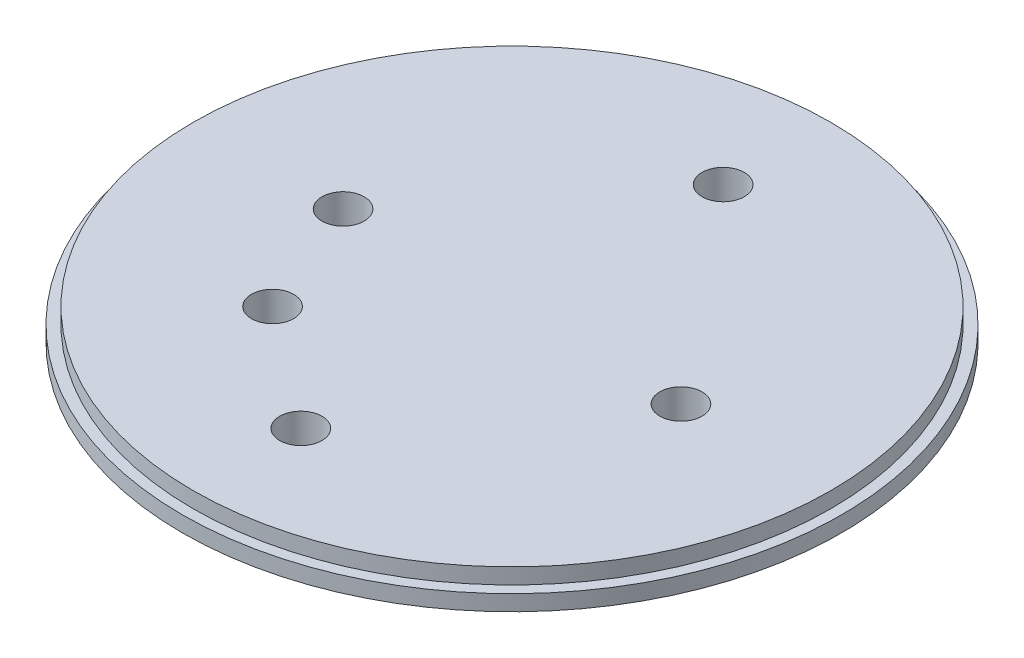
from build123d import *

# Parameters (mm, degrees)
SKETCH1_R           = 49.55
BOSS_EXTRUDE1_DEPTH = 2.36
SKETCH2_R           = 47.95
BOSS_EXTRUDE2_DEPTH = 2.36
SKETCH3_R           = 3.175
CUT_EXTRUDE1_DEPTH  = 71.233064863


with BuildPart() as part:
    # Sketch1 → Boss-Extrude1 (new body)
    with BuildSketch(Plane(origin=(0, 0, 0), x_dir=(1, 0, 0), z_dir=(0, 1, 0))):
        Circle(SKETCH1_R)
    extrude(amount=BOSS_EXTRUDE1_DEPTH)

    # Sketch2 → Boss-Extrude2 (add)
    with BuildSketch(Plane(origin=(0, 2.36, 0), x_dir=(1, 0, 0), z_dir=(0, 1, 0))):
        Circle(SKETCH2_R)
    extrude(amount=BOSS_EXTRUDE2_DEPTH)

    # Sketch3 → Cut-Extrude1 (cut, through all)
    with BuildSketch(Plane.XZ):
        with Locations((25.4, 0)):
            Circle(SKETCH3_R)
        with Locations((-25.4, 0)):
            Circle(SKETCH3_R)
        with Locations((0, 31.75)):
            Circle(SKETCH3_R)
        with Locations((0, -31.75)):
            Circle(SKETCH3_R)
        with Locations((-18, 18)):
            Circle(SKETCH3_R)
    extrude(amount=-CUT_EXTRUDE1_DEPTH, mode=Mode.SUBTRACT)


solid = part.part
